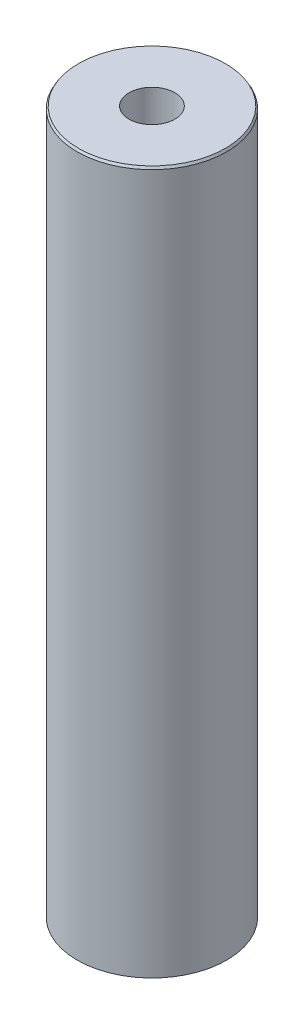
from build123d import *
from OCP.BRepFilletAPI import BRepFilletAPI_MakeChamfer

# Parameters (mm, degrees)
SKETCH1_R           = 55
BOSS_EXTRUDE1_DEPTH = 517.479813478
SKETCH2_R           = 16.853301344
CUT_EXTRUDE1_DEPTH  = 524.292802699
CHAMFER1_SIZE       = 1.713110409
CHAMFER1_SIZE2      = 0.989064756


with BuildPart() as part:
    # Sketch1 → Boss-Extrude1 (new body)
    with BuildSketch(Plane(origin=(0, 0, 0), x_dir=(1, 0, 0), z_dir=(0, 1, 0))):
        Circle(SKETCH1_R)
    extrude(amount=BOSS_EXTRUDE1_DEPTH)

    # Sketch2 → Cut-Extrude1 (cut, through all)
    with BuildSketch(Plane(origin=(0, 0, 0), x_dir=(1, 0, 0), z_dir=(0, 1, 0))):
        Circle(SKETCH2_R)
    extrude(amount=CUT_EXTRUDE1_DEPTH, mode=Mode.SUBTRACT)

    # Chamfer1: one chamfer whose edges measure the first distance from different faces: ONE call of the kernel's chamfer builder (chamfer() names one face for all edges)
    chamfer1_edges_1 = [part.edges().sort_by_distance(p)[0] for p in [
        (-55, 517.479813478, 0),
    ]]
    chamfer1_side_1 = [part.faces().sort_by_distance(p)[0] for p in [
        (-55, 258.739906739, 0),
    ]]
    chamfer1_edges_2 = [part.edges().sort_by_distance(p)[0] for p in [
        (-55, 0, 0),
    ]]
    chamfer1_side_2 = [part.faces().sort_by_distance(p)[0] for p in [
        (-53.444365081, 0, 0),
    ]]
    chamfer1 = BRepFilletAPI_MakeChamfer(part.part.solid().wrapped)
    for e in chamfer1_edges_1:
        chamfer1.Add(CHAMFER1_SIZE, CHAMFER1_SIZE2, e.wrapped, chamfer1_side_1[0].wrapped)  # the first distance lies on this face
    for e in chamfer1_edges_2:
        chamfer1.Add(CHAMFER1_SIZE, CHAMFER1_SIZE2, e.wrapped, chamfer1_side_2[0].wrapped)  # the first distance lies on this face
    add(Compound.cast(chamfer1.Shape()), mode=Mode.REPLACE)


solid = part.part
